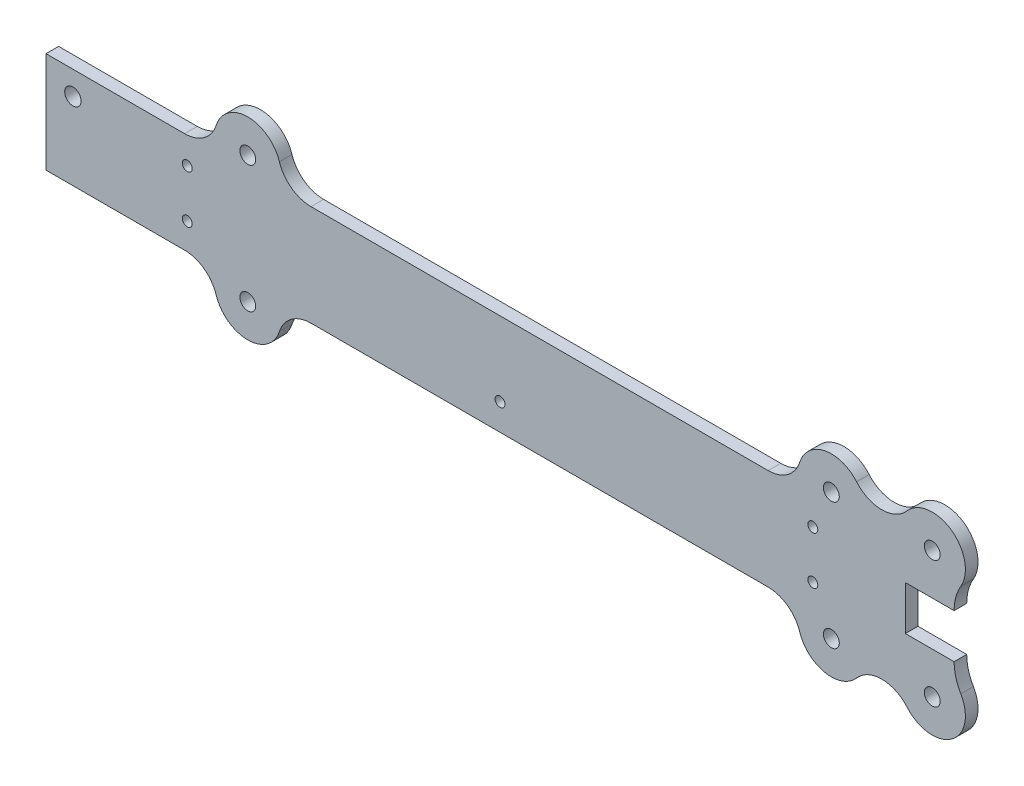
from build123d import *

# Parameters (mm, degrees)
SKETCH1_R           = 4.127
SKETCH1_R_2         = 4
SKETCH1_R_3         = 2.4892
BOSS_EXTRUDE1_DEPTH = 6.35


with BuildPart() as part:
    # Sketch1 → Boss-Extrude1 (new body)
    with BuildSketch(Plane.XY):
        with BuildLine():
            Line((0, 50.8), (69.782797106, 50.8))
            ThreePointArc((69.782797106, 50.8), (79.63302553, 54.01434095), (85.691398553, 62.42))
            ThreePointArc((85.691398553, 62.42), (101.6, 74.04), (117.508601447, 62.42))
            ThreePointArc((117.508601447, 62.42), (123.56697447, 54.01434095), (133.417202894, 50.8))
            Line((133.417202894, 50.8), (363.582797106, 50.8))
            ThreePointArc((363.582797106, 50.8), (373.43302553, 54.01434095), (379.491398553, 62.42))
            ThreePointArc((379.491398553, 62.42), (392.101405867, 73.710988875), (408.1, 68.184353369))
            ThreePointArc((408.1, 68.184353369), (420.8, 62.328706739), (433.5, 68.184353369))
            ThreePointArc((433.5, 68.184353369), (455.911441752, 70.92594491), (460.571129688, 48.833494754))
            ThreePointArc((460.571129688, 48.833494754), (458.058009173, 42.90331161), (457.2, 36.52))
            Line((457.2, 36.52), (432.660000058, 36.52))
            Line((432.660000058, 36.52), (432.660000058, 14.28))
            Line((432.660000058, 14.28), (457.2, 14.28))
            ThreePointArc((457.2, 14.28), (458.058009173, 7.89668839), (460.571129688, 1.966505246))
            ThreePointArc((460.571129688, 1.966505246), (455.911441752, -20.12594491), (433.5, -17.384353369))
            ThreePointArc((433.5, -17.384353369), (420.8, -11.528706739), (408.1, -17.384353369))
            ThreePointArc((408.1, -17.384353369), (392.101405867, -22.910988875), (379.491398553, -11.62))
            ThreePointArc((379.491398553, -11.62), (373.43302553, -3.21434095), (363.582797106, 0))
            Line((363.582797106, 0), (133.417202894, 0))
            ThreePointArc((133.417202894, 0), (123.56697447, -3.21434095), (117.508601447, -11.62))
            ThreePointArc((117.508601447, -11.62), (101.6, -23.24), (85.691398553, -11.62))
            ThreePointArc((85.691398553, -11.62), (79.63302553, -3.21434095), (69.782797106, 0))
            Line((69.782797106, 0), (0, 0))
            Line((0, 0), (0, 50.8))
        make_face()
        with Locations((13.54, 38.94)):
            Circle(SKETCH1_R, mode=Mode.SUBTRACT)
        with Locations((101.6, -6.54)):
            Circle(SKETCH1_R_2, mode=Mode.SUBTRACT)
        with Locations((386.08, 13.3425)):
            Circle(SKETCH1_R_3, mode=Mode.SUBTRACT)
        with Locations((386.08, 37.4575)):
            Circle(SKETCH1_R_3, mode=Mode.SUBTRACT)
        with Locations((228.6, 13.3425)):
            Circle(SKETCH1_R_3, mode=Mode.SUBTRACT)
        with Locations((71.12, 13.3425)):
            Circle(SKETCH1_R_3, mode=Mode.SUBTRACT)
        with Locations((71.12, 37.4575)):
            Circle(SKETCH1_R_3, mode=Mode.SUBTRACT)
        with Locations((101.6, 57.34)):
            Circle(SKETCH1_R_2, mode=Mode.SUBTRACT)
        with Locations((395.4, 57.34)):
            Circle(SKETCH1_R_2, mode=Mode.SUBTRACT)
        with Locations((446.2, 57.34)):
            Circle(SKETCH1_R_2, mode=Mode.SUBTRACT)
        with Locations((446.2, -6.54)):
            Circle(SKETCH1_R_2, mode=Mode.SUBTRACT)
        with Locations((395.4, -6.54)):
            Circle(SKETCH1_R_2, mode=Mode.SUBTRACT)
    extrude(amount=BOSS_EXTRUDE1_DEPTH)


solid = part.part
